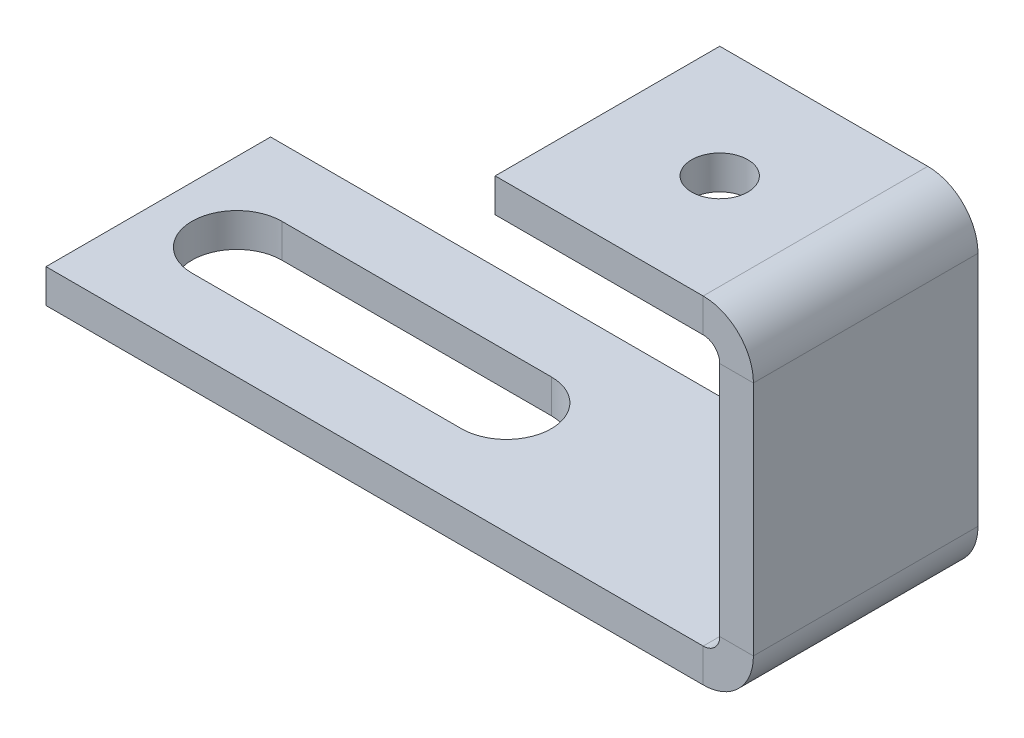
from build123d import *

# Parameters (mm, degrees)
SM_BASE_FLANGE_1_DEPTH = 10
HOLE_WIZARD_M3_1_D     = 2.5
HOLE_WIZARD_M3_1_DEPTH = 1.5
F_4_0MM_1_D            = 4
CUT_EXTRUDE_1_DEPTH    = 10


# Sheet-metal steps are written as plain solids
with BuildPart() as part:
    # Sketch 1 → 基材-凸緣1 (new body)
    with BuildSketch(Plane.XY):
        with BuildLine():
            Line((-30, 0), (-0.7366, 0))
            ThreePointArc((-0.7366, 0), (-0.215745145, 0.215745145), (0, 0.7366))
            Line((0, 0.7366), (0, 11.2634))
            ThreePointArc((0, 11.2634), (-0.215745145, 11.784254855), (-0.7366, 12))
            Line((-0.7366, 12), (-10, 12))
            Line((-10, 12), (-10, 13.5))
            Line((-10, 13.5), (-0.7366, 13.5))
            ThreePointArc((-0.7366, 13.5), (0.844915027, 12.844915027), (1.5, 11.2634))
            Line((1.5, 11.2634), (1.5, 0.7366))
            ThreePointArc((1.5, 0.7366), (0.844915027, -0.844915027), (-0.7366, -1.5))
            Line((-0.7366, -1.5), (-30, -1.5))
            Line((-30, -1.5), (-30, 0))
        make_face()
    extrude(amount=SM_BASE_FLANGE_1_DEPTH)

    # M3 螺紋孔1
    with Locations(Plane(origin=(0, 13.5, 0), x_dir=(1, 0, 0), z_dir=(0, 1, 0))):
        with Locations((-5, -5)):
            Hole(HOLE_WIZARD_M3_1_D / 2, depth=HOLE_WIZARD_M3_1_DEPTH)

    # Ø4.0mm 定位孔1 (through all)
    with Locations(Plane(origin=(0, -1.5, 0), x_dir=(-1, 0, 0), z_dir=(0, -1, 0))):
        with Locations((26, -5), (18, -5)):
            Hole(F_4_0MM_1_D / 2)

    # 草圖11 → 除料-伸長1 (cut)
    with BuildSketch(Plane(origin=(0, 0, 0), x_dir=(1, 0, 0), z_dir=(0, 1, 0))):
        with BuildLine():
            Line((-14.5, -7), (-26.5, -7))
            ThreePointArc((-26.5, -7), (-28.5, -5), (-26.5, -3))
            Line((-26.5, -3), (-14.5, -3))
            ThreePointArc((-14.5, -3), (-12.5, -5), (-14.5, -7))
        make_face()
    extrude(amount=-CUT_EXTRUDE_1_DEPTH, mode=Mode.SUBTRACT)


solid = part.part
